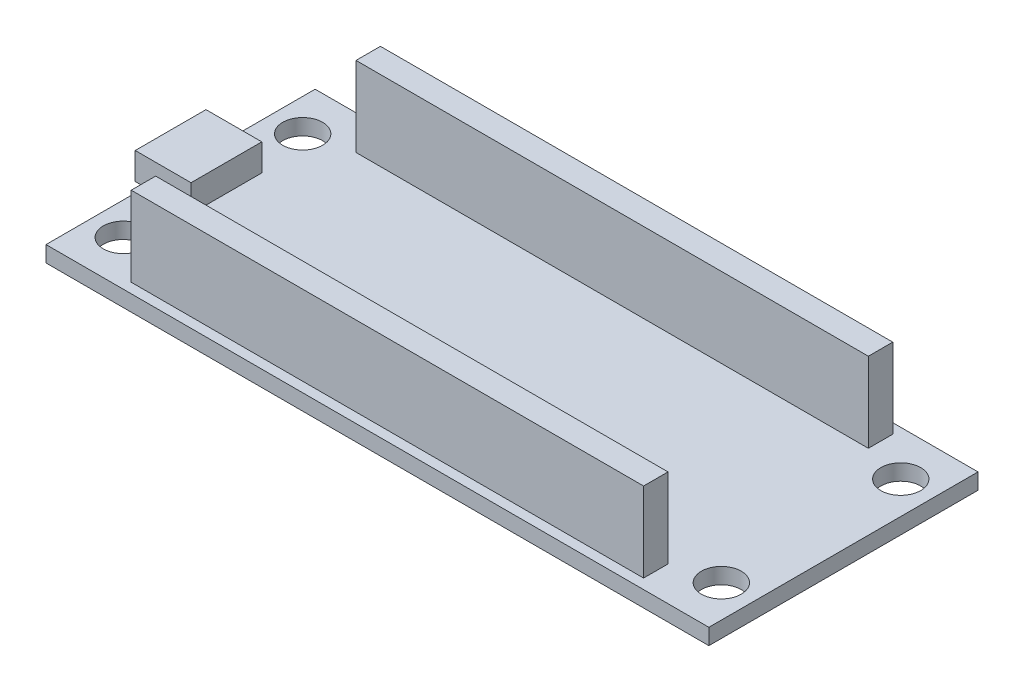
from build123d import *

# Parameters (mm, degrees)
SKETCH1_W           = 66.5
SKETCH1_H           = 27
SKETCH1_R           = 2
BOSS_EXTRUDE1_DEPTH = 1.6
SKETCH2_W           = 5.6
SKETCH2_H           = 7.1
BOSS_EXTRUDE2_DEPTH = 2.7
SKETCH3_W           = 51.4
SKETCH3_H           = 2.45
BOSS_EXTRUDE3_DEPTH = 8


with BuildPart() as part:
    # Sketch1 → Boss-Extrude1 (new body)
    with BuildSketch(Plane(origin=(0, 0, 0), x_dir=(1, 0, 0), z_dir=(0, 1, 0))):
        Rectangle(SKETCH1_W, SKETCH1_H)
        with Locations((-30, 9)):
            Circle(SKETCH1_R, mode=Mode.SUBTRACT)
        with Locations((-30, -9)):
            Circle(SKETCH1_R, mode=Mode.SUBTRACT)
        with Locations((30, -9)):
            Circle(SKETCH1_R, mode=Mode.SUBTRACT)
        with Locations((30, 9)):
            Circle(SKETCH1_R, mode=Mode.SUBTRACT)
    extrude(amount=BOSS_EXTRUDE1_DEPTH)

    # Sketch2 → Boss-Extrude2 (add)
    with BuildSketch(Plane(origin=(0, 1.6, 0), x_dir=(1, 0, 0), z_dir=(0, 1, 0))):
        with Locations((-31.45, 0)):
            Rectangle(SKETCH2_W, SKETCH2_H)
    extrude(amount=BOSS_EXTRUDE2_DEPTH)

    # Sketch3 → Boss-Extrude3 (add)
    with BuildSketch(Plane(origin=(0, 1.6, 0), x_dir=(1, 0, 0), z_dir=(0, 1, 0))):
        with Locations((0, 11.275)):
            Rectangle(SKETCH3_W, SKETCH3_H)
        with Locations((0, -11.275)):
            Rectangle(SKETCH3_W, SKETCH3_H)
    extrude(amount=BOSS_EXTRUDE3_DEPTH)


solid = part.part
